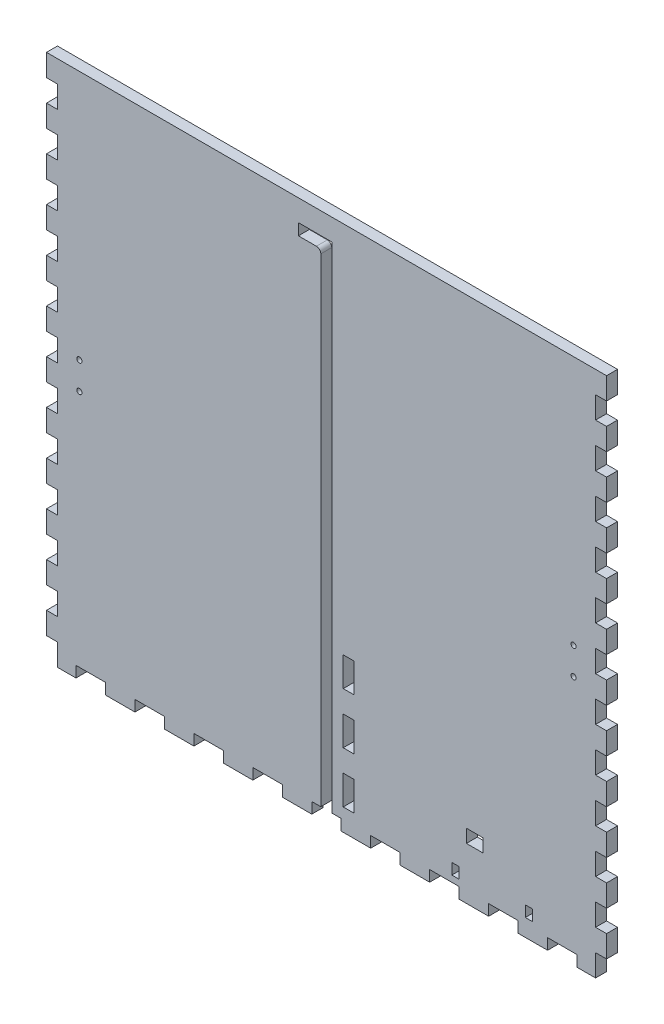
from build123d import *

# Parameters (mm, degrees)
SKETCH1_W              = 323.85
SKETCH1_H              = 139.7
BOSS_EXTRUDE1_DEPTH    = 6.35
SKETCH2_W              = 323.85
SKETCH2_H              = 139.7
SKETCH2_W_2            = 311.15
SKETCH2_H_2            = 127
BOSS_EXTRUDE2_DEPTH    = 298.45
SKETCH3_W              = 6.35
SKETCH3_H              = 16.933333333
SKETCH3_H_2            = 16.933333334
DOOR_SLOT_DEPTH        = 12.7
DOOR_GUIDE_HOLES_REACH = 372.007
SKETCH4_W              = 6.35
SKETCH4_H              = 15.875
LEVER_HOLES_R          = 1.5
LEVER_HOLES_W          = 9.652
LEVER_HOLES_H          = 7.62
LEVER_HOLES_W_2        = 4
LEVER_HOLES_H_2        = 6.35
LEVERHOLE_CUT_DEPTH    = 373.342363457
CUT_EXTRUDE2_REACH     = 452.179
SKETCH7_R              = 3.175
SKETCH7_R_2            = 26.9875
CUT_EXTRUDE3_REACH     = 452.179
SKETCH8_R              = 3.175
SKETCH15_W             = 133.35
SKETCH15_H             = 338.76825338
CUT_EXTRUDE8_DEPTH     = 451.178725619
FRONT_BACK_W           = 6.35
FRONT_BACK_H           = 12.7
FRONT_BACK_W_2         = 17.044736842
FRONT_BACK_H_2         = 6.35
CUT_EXTRUDE9_DEPTH     = 346.200040737


with BuildPart() as part:
    # Sketch1 → Boss-Extrude1 (new body)
    with BuildSketch(Plane(origin=(0, 0, 0), x_dir=(1, 0, 0), z_dir=(0, 1, 0))):
        Rectangle(SKETCH1_W, SKETCH1_H)
    extrude(amount=BOSS_EXTRUDE1_DEPTH)

    # Sketch2 → Boss-Extrude2 (add)
    with BuildSketch(Plane(origin=(0, 6.35, 0), x_dir=(1, 0, 0), z_dir=(0, 1, 0))):
        Rectangle(SKETCH2_W, SKETCH2_H)
        Rectangle(SKETCH2_W_2, SKETCH2_H_2, mode=Mode.SUBTRACT)
    extrude(amount=BOSS_EXTRUDE2_DEPTH)

    # Sketch3 → Door Slot (cut)
    with BuildSketch(Plane.XY.offset(69.85)):
        with BuildLine():
            Line((-3.302, 283.21), (-3.302, 6.35))
            Line((-3.302, 6.35), (3.302, 6.35))
            Line((3.302, 6.35), (3.302, 292.354))
            Line((3.302, 292.354), (-16.256, 292.354))
            Line((-16.256, 292.354), (-16.256, 285.75))
            Line((-16.256, 285.75), (-5.842, 285.75))
            ThreePointArc((-5.842, 285.75), (-4.045948776, 285.006051224), (-3.302, 283.21))
        make_face()
        with Locations((12.827, 80.433333334)):
            Rectangle(SKETCH3_W, SKETCH3_H)
        with Locations((12.827, 50.8)):
            Rectangle(SKETCH3_W, SKETCH3_H_2)
        with Locations((12.827, 21.166666667)):
            Rectangle(SKETCH3_W, SKETCH3_H)
    extrude(amount=-DOOR_SLOT_DEPTH, mode=Mode.SUBTRACT)

    # Sketch4 → Door Guide Holes (cut, up to next)
    with BuildSketch(Plane.XY.offset(-63.5), mode=Mode.PRIVATE) as door_guide_holes_sk1:
        with Locations((-19.431, 284.1625)):
            Rectangle(SKETCH4_W, SKETCH4_H)
    door_guide_holes_tool1 = extrude(door_guide_holes_sk1.sketch, amount=-DOOR_GUIDE_HOLES_REACH, mode=Mode.PRIVATE) & part.part
    # Sketch4 → Door Guide Holes (cut, up to next)
    with BuildSketch(Plane.XY.offset(-63.5), mode=Mode.PRIVATE) as door_guide_holes_sk2:
        with Locations((-19.431, 255.5875)):
            Rectangle(SKETCH4_W, SKETCH4_H)
    door_guide_holes_tool2 = extrude(door_guide_holes_sk2.sketch, amount=-DOOR_GUIDE_HOLES_REACH, mode=Mode.PRIVATE) & part.part
    # Sketch4 → Door Guide Holes (cut, up to next)
    with BuildSketch(Plane.XY.offset(-63.5), mode=Mode.PRIVATE) as door_guide_holes_sk3:
        with Locations((-19.431, 227.0125)):
            Rectangle(SKETCH4_W, SKETCH4_H)
    door_guide_holes_tool3 = extrude(door_guide_holes_sk3.sketch, amount=-DOOR_GUIDE_HOLES_REACH, mode=Mode.PRIVATE) & part.part
    # Sketch4 → Door Guide Holes (cut, up to next)
    with BuildSketch(Plane.XY.offset(-63.5), mode=Mode.PRIVATE) as door_guide_holes_sk4:
        with Locations((-19.431, 198.4375)):
            Rectangle(SKETCH4_W, SKETCH4_H)
    door_guide_holes_tool4 = extrude(door_guide_holes_sk4.sketch, amount=-DOOR_GUIDE_HOLES_REACH, mode=Mode.PRIVATE) & part.part
    # Sketch4 → Door Guide Holes (cut, up to next)
    with BuildSketch(Plane.XY.offset(-63.5), mode=Mode.PRIVATE) as door_guide_holes_sk5:
        with Locations((-19.431, 169.8625)):
            Rectangle(SKETCH4_W, SKETCH4_H)
    door_guide_holes_tool5 = extrude(door_guide_holes_sk5.sketch, amount=-DOOR_GUIDE_HOLES_REACH, mode=Mode.PRIVATE) & part.part
    # Sketch4 → Door Guide Holes (cut, up to next)
    with BuildSketch(Plane.XY.offset(-63.5), mode=Mode.PRIVATE) as door_guide_holes_sk6:
        with Locations((-19.431, 141.2875)):
            Rectangle(SKETCH4_W, SKETCH4_H)
    door_guide_holes_tool6 = extrude(door_guide_holes_sk6.sketch, amount=-DOOR_GUIDE_HOLES_REACH, mode=Mode.PRIVATE) & part.part
    # Sketch4 → Door Guide Holes (cut, up to next)
    with BuildSketch(Plane.XY.offset(-63.5), mode=Mode.PRIVATE) as door_guide_holes_sk7:
        with Locations((-19.431, 112.7125)):
            Rectangle(SKETCH4_W, SKETCH4_H)
    door_guide_holes_tool7 = extrude(door_guide_holes_sk7.sketch, amount=-DOOR_GUIDE_HOLES_REACH, mode=Mode.PRIVATE) & part.part
    # Sketch4 → Door Guide Holes (cut, up to next)
    with BuildSketch(Plane.XY.offset(-63.5), mode=Mode.PRIVATE) as door_guide_holes_sk8:
        with Locations((-19.431, 84.1375)):
            Rectangle(SKETCH4_W, SKETCH4_H)
    door_guide_holes_tool8 = extrude(door_guide_holes_sk8.sketch, amount=-DOOR_GUIDE_HOLES_REACH, mode=Mode.PRIVATE) & part.part
    # Sketch4 → Door Guide Holes (cut, up to next)
    with BuildSketch(Plane.XY.offset(-63.5), mode=Mode.PRIVATE) as door_guide_holes_sk9:
        with Locations((-19.431, 55.5625)):
            Rectangle(SKETCH4_W, SKETCH4_H)
    door_guide_holes_tool9 = extrude(door_guide_holes_sk9.sketch, amount=-DOOR_GUIDE_HOLES_REACH, mode=Mode.PRIVATE) & part.part
    # Sketch4 → Door Guide Holes (cut, up to next)
    with BuildSketch(Plane.XY.offset(-63.5), mode=Mode.PRIVATE) as door_guide_holes_sk10:
        with Locations((-19.431, 26.9875)):
            Rectangle(SKETCH4_W, SKETCH4_H)
    door_guide_holes_tool10 = extrude(door_guide_holes_sk10.sketch, amount=-DOOR_GUIDE_HOLES_REACH, mode=Mode.PRIVATE) & part.part
    door_guide_holes_1 = door_guide_holes_tool1.solids().sort_by_distance((-19.431, 284.1625, -63.5))[0]
    add(door_guide_holes_1, mode=Mode.SUBTRACT)
    door_guide_holes_2 = door_guide_holes_tool2.solids().sort_by_distance((-19.431, 255.5875, -63.5))[0]
    add(door_guide_holes_2, mode=Mode.SUBTRACT)
    door_guide_holes_3 = door_guide_holes_tool3.solids().sort_by_distance((-19.431, 227.0125, -63.5))[0]
    add(door_guide_holes_3, mode=Mode.SUBTRACT)
    door_guide_holes_4 = door_guide_holes_tool4.solids().sort_by_distance((-19.431, 198.4375, -63.5))[0]
    add(door_guide_holes_4, mode=Mode.SUBTRACT)
    door_guide_holes_5 = door_guide_holes_tool5.solids().sort_by_distance((-19.431, 169.8625, -63.5))[0]
    add(door_guide_holes_5, mode=Mode.SUBTRACT)
    door_guide_holes_6 = door_guide_holes_tool6.solids().sort_by_distance((-19.431, 141.2875, -63.5))[0]
    add(door_guide_holes_6, mode=Mode.SUBTRACT)
    door_guide_holes_7 = door_guide_holes_tool7.solids().sort_by_distance((-19.431, 112.7125, -63.5))[0]
    add(door_guide_holes_7, mode=Mode.SUBTRACT)
    door_guide_holes_8 = door_guide_holes_tool8.solids().sort_by_distance((-19.431, 84.1375, -63.5))[0]
    add(door_guide_holes_8, mode=Mode.SUBTRACT)
    door_guide_holes_9 = door_guide_holes_tool9.solids().sort_by_distance((-19.431, 55.5625, -63.5))[0]
    add(door_guide_holes_9, mode=Mode.SUBTRACT)
    door_guide_holes_10 = door_guide_holes_tool10.solids().sort_by_distance((-19.431, 26.9875, -63.5))[0]
    add(door_guide_holes_10, mode=Mode.SUBTRACT)
    door_guide_holes = door_guide_holes_1 + door_guide_holes_2 + door_guide_holes_3 + door_guide_holes_4 + door_guide_holes_5 + door_guide_holes_6 + door_guide_holes_7 + door_guide_holes_8 + door_guide_holes_9 + door_guide_holes_10  # Door Guide Holes as one shape, for the pattern or mirror that repeats it

    # Mirror1: Door Guide Holes across plane
    add(door_guide_holes.mirror(Plane.ZY.offset(6.477)), mode=Mode.SUBTRACT)

    # Lever Holes → LeverHole Cut (cut, through all)
    with BuildSketch(Plane.XY.offset(69.85)):
        with Locations((142.875, 160.275)):
            Circle(LEVER_HOLES_R)
        with Locations((142.875, 144.525)):
            Circle(LEVER_HOLES_R)
        with Locations((-142.875, 160.275)):
            Circle(LEVER_HOLES_R)
        with Locations((-142.875, 144.525)):
            Circle(LEVER_HOLES_R)
        with Locations((85.725, 33.8749894)):
            Rectangle(LEVER_HOLES_W, LEVER_HOLES_H)
        with Locations((74.475, 13.175)):
            Rectangle(LEVER_HOLES_W_2, LEVER_HOLES_H_2)
        with Locations((116.975, 13.175)):
            Rectangle(LEVER_HOLES_W_2, LEVER_HOLES_H_2)
    extrude(amount=-LEVERHOLE_CUT_DEPTH, mode=Mode.SUBTRACT)

    # Sketch7 → Cut-Extrude2 (cut, up to next)
    with BuildSketch(Plane(origin=(161.925, 0, 0), x_dir=(0, 0, -1), z_dir=(1, 0, 0)), mode=Mode.PRIVATE) as cut_extrude2_sk1:
        with Locations((-37.211, 92.583)):
            Circle(SKETCH7_R)
    cut_extrude2_tool1 = extrude(cut_extrude2_sk1.sketch, amount=-CUT_EXTRUDE2_REACH, mode=Mode.PRIVATE) & part.part
    # Sketch7 → Cut-Extrude2 (cut, up to next)
    with BuildSketch(Plane(origin=(161.925, 0, 0), x_dir=(0, 0, -1), z_dir=(1, 0, 0)), mode=Mode.PRIVATE) as cut_extrude2_sk2:
        with Locations((37.211, 92.583)):
            Circle(SKETCH7_R)
    cut_extrude2_tool2 = extrude(cut_extrude2_sk2.sketch, amount=-CUT_EXTRUDE2_REACH, mode=Mode.PRIVATE) & part.part
    # Sketch7 → Cut-Extrude2 (cut, up to next)
    with BuildSketch(Plane(origin=(161.925, 0, 0), x_dir=(0, 0, -1), z_dir=(1, 0, 0)), mode=Mode.PRIVATE) as cut_extrude2_sk3:
        with Locations((-37.211, 18.161)):
            Circle(SKETCH7_R)
    cut_extrude2_tool3 = extrude(cut_extrude2_sk3.sketch, amount=-CUT_EXTRUDE2_REACH, mode=Mode.PRIVATE) & part.part
    # Sketch7 → Cut-Extrude2 (cut, up to next)
    with BuildSketch(Plane(origin=(161.925, 0, 0), x_dir=(0, 0, -1), z_dir=(1, 0, 0)), mode=Mode.PRIVATE) as cut_extrude2_sk4:
        with Locations((37.211, 18.161)):
            Circle(SKETCH7_R)
    cut_extrude2_tool4 = extrude(cut_extrude2_sk4.sketch, amount=-CUT_EXTRUDE2_REACH, mode=Mode.PRIVATE) & part.part
    # Sketch7 → Cut-Extrude2 (cut, up to next)
    with BuildSketch(Plane(origin=(161.925, 0, 0), x_dir=(0, 0, -1), z_dir=(1, 0, 0)), mode=Mode.PRIVATE) as cut_extrude2_sk5:
        with Locations((0, 55.372)):
            Circle(SKETCH7_R_2)
    cut_extrude2_tool5 = extrude(cut_extrude2_sk5.sketch, amount=-CUT_EXTRUDE2_REACH, mode=Mode.PRIVATE) & part.part
    add(cut_extrude2_tool1.solids().sort_by_distance((161.925, 92.583, 37.211))[0], mode=Mode.SUBTRACT)
    add(cut_extrude2_tool2.solids().sort_by_distance((161.925, 92.583, -37.211))[0], mode=Mode.SUBTRACT)
    add(cut_extrude2_tool3.solids().sort_by_distance((161.925, 18.161, 37.211))[0], mode=Mode.SUBTRACT)
    add(cut_extrude2_tool4.solids().sort_by_distance((161.925, 18.161, -37.211))[0], mode=Mode.SUBTRACT)
    add(cut_extrude2_tool5.solids().sort_by_distance((161.925, 55.372, 0))[0], mode=Mode.SUBTRACT)

    # Sketch8 → Cut-Extrude3 (cut, up to next)
    with BuildSketch(Plane.ZY.offset(161.925), mode=Mode.PRIVATE) as cut_extrude3_sk1:
        with Locations((0, 19.05)):
            Circle(SKETCH8_R)
    cut_extrude3_tool1 = extrude(cut_extrude3_sk1.sketch, amount=-CUT_EXTRUDE3_REACH, mode=Mode.PRIVATE) & part.part
    add(cut_extrude3_tool1.solids().sort_by_distance((-161.925, 19.05, 0))[0], mode=Mode.SUBTRACT)

    # Sketch15 → Cut-Extrude8 (cut, through all)
    with BuildSketch(Plane.ZY.offset(161.925)):
        with Locations((-3.175, 135.41587331)):
            Rectangle(SKETCH15_W, SKETCH15_H)
    extrude(amount=-CUT_EXTRUDE8_DEPTH, mode=Mode.SUBTRACT)

    # Front/Back → Cut-Extrude9 (cut, through all)
    with BuildSketch(Plane.XY.offset(69.85)):
        with Locations((-158.75, 6.35)):
            Rectangle(FRONT_BACK_W, FRONT_BACK_H)
        with Locations((-136.357894737, 3.175)):
            Rectangle(FRONT_BACK_W_2, FRONT_BACK_H_2)
        with Locations((-158.75, 31.75)):
            Rectangle(FRONT_BACK_W, FRONT_BACK_H)
        with Locations((-102.268421053, 3.175)):
            Rectangle(FRONT_BACK_W_2, FRONT_BACK_H_2)
        with Locations((-158.75, 57.15)):
            Rectangle(FRONT_BACK_W, FRONT_BACK_H)
        with Locations((-68.178947368, 3.175)):
            Rectangle(FRONT_BACK_W_2, FRONT_BACK_H_2)
        with Locations((-158.75, 82.55)):
            Rectangle(FRONT_BACK_W, FRONT_BACK_H)
        with Locations((-34.089473684, 3.175)):
            Rectangle(FRONT_BACK_W_2, FRONT_BACK_H_2)
        with Locations((-158.75, 107.95)):
            Rectangle(FRONT_BACK_W, FRONT_BACK_H)
        with Locations((0, 3.175)):
            Rectangle(FRONT_BACK_W_2, FRONT_BACK_H_2)
        with Locations((-158.75, 133.35)):
            Rectangle(FRONT_BACK_W, FRONT_BACK_H)
        with Locations((34.089473684, 3.175)):
            Rectangle(FRONT_BACK_W_2, FRONT_BACK_H_2)
        with Locations((-158.75, 158.75)):
            Rectangle(FRONT_BACK_W, FRONT_BACK_H)
        with Locations((68.178947368, 3.175)):
            Rectangle(FRONT_BACK_W_2, FRONT_BACK_H_2)
        with Locations((-158.75, 184.15)):
            Rectangle(FRONT_BACK_W, FRONT_BACK_H)
        with Locations((102.268421053, 3.175)):
            Rectangle(FRONT_BACK_W_2, FRONT_BACK_H_2)
        with Locations((-158.75, 209.55)):
            Rectangle(FRONT_BACK_W, FRONT_BACK_H)
        with Locations((136.357894737, 3.175)):
            Rectangle(FRONT_BACK_W_2, FRONT_BACK_H_2)
        with Locations((-158.75, 234.95)):
            Rectangle(FRONT_BACK_W, FRONT_BACK_H)
        with Locations((158.75, 6.35)):
            Rectangle(FRONT_BACK_W, FRONT_BACK_H)
        with Locations((-158.75, 260.35)):
            Rectangle(FRONT_BACK_W, FRONT_BACK_H)
        with Locations((158.75, 31.75)):
            Rectangle(FRONT_BACK_W, FRONT_BACK_H)
        with Locations((-158.75, 285.75)):
            Rectangle(FRONT_BACK_W, FRONT_BACK_H)
        with Locations((158.75, 57.15)):
            Rectangle(FRONT_BACK_W, FRONT_BACK_H)
        with Locations((158.75, 82.55)):
            Rectangle(FRONT_BACK_W, FRONT_BACK_H)
        with Locations((158.75, 107.95)):
            Rectangle(FRONT_BACK_W, FRONT_BACK_H)
        with Locations((158.75, 133.35)):
            Rectangle(FRONT_BACK_W, FRONT_BACK_H)
        with Locations((158.75, 158.75)):
            Rectangle(FRONT_BACK_W, FRONT_BACK_H)
        with Locations((158.75, 184.15)):
            Rectangle(FRONT_BACK_W, FRONT_BACK_H)
        with Locations((158.75, 209.55)):
            Rectangle(FRONT_BACK_W, FRONT_BACK_H)
        with Locations((158.75, 234.95)):
            Rectangle(FRONT_BACK_W, FRONT_BACK_H)
        with Locations((158.75, 260.35)):
            Rectangle(FRONT_BACK_W, FRONT_BACK_H)
        with Locations((158.75, 285.75)):
            Rectangle(FRONT_BACK_W, FRONT_BACK_H)
    extrude(amount=-CUT_EXTRUDE9_DEPTH, mode=Mode.SUBTRACT)


solid = part.part
